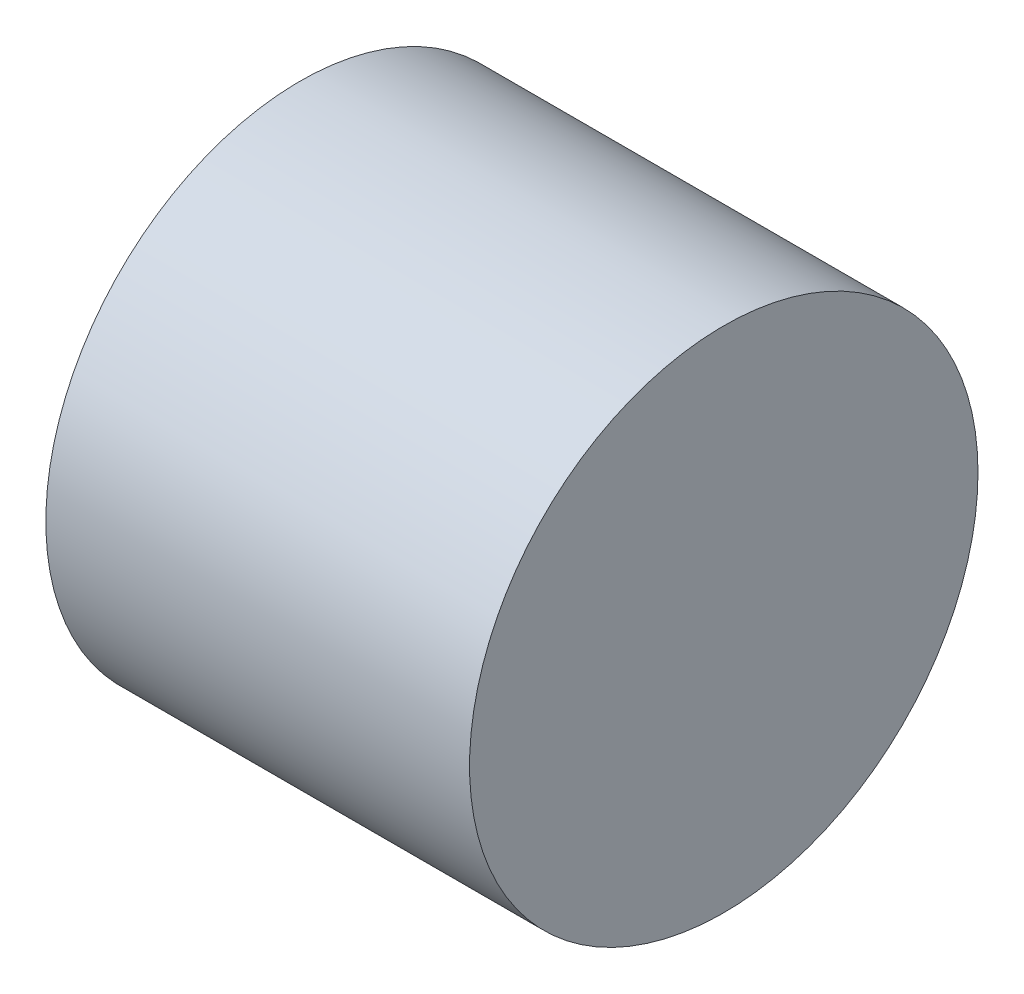
from build123d import *

# Parameters (mm, degrees)
SKETCH1_R           = 150
BOSS_EXTRUDE1_DEPTH = 250


with BuildPart() as part:
    # Sketch1 → Boss-Extrude1 (new body)
    with BuildSketch(Plane(origin=(0, 0, 0), x_dir=(0, 0, -1), z_dir=(1, 0, 0))):
        Circle(SKETCH1_R)
    extrude(amount=BOSS_EXTRUDE1_DEPTH)


solid = part.part
